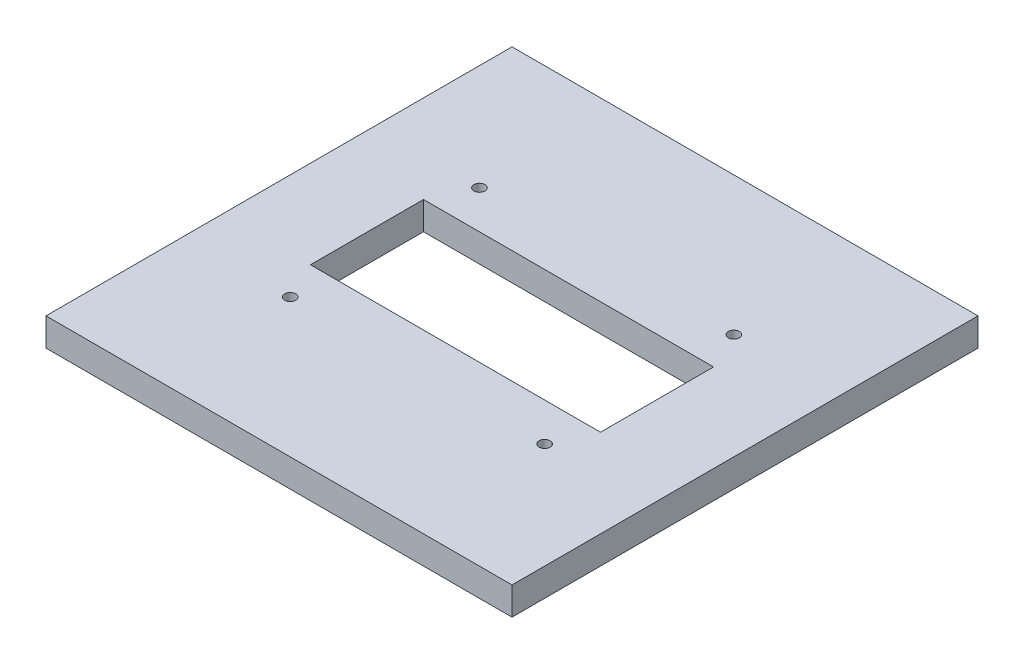
from build123d import *

# Parameters (mm, degrees)
ESBO_O1_W             = 50
ESBO_O1_H             = 50
BASE_DEPTH            = 3
ENTRADASESB_R         = 0.595
ENTRADASESB_W         = 31.12
ENTRADASESB_H         = 12.13
CORTE_EXTRUS_O1_DEPTH = 3


with BuildPart() as part:
    # Esboço1 → Base (new body)
    with BuildSketch(Plane(origin=(0, 0, 0), x_dir=(1, 0, 0), z_dir=(0, 1, 0))):
        with Locations((25, 25)):
            Rectangle(ESBO_O1_W, ESBO_O1_H)
    extrude(amount=BASE_DEPTH)

    # EntradasEsb → Corte-extrusão1 (cut)
    with BuildSketch(Plane(origin=(0, 3, 0), x_dir=(1, 0, 0), z_dir=(0, 1, 0))):
        with Locations((11.35, 35.155)):
            Circle(ENTRADASESB_R)
        with Locations((38.65, 35.155)):
            Circle(ENTRADASESB_R)
        with Locations((38.65, 14.845)):
            Circle(ENTRADASESB_R)
        with Locations((11.35, 14.845)):
            Circle(ENTRADASESB_R)
        with Locations((25, 25)):
            Rectangle(ENTRADASESB_W, ENTRADASESB_H)
    extrude(amount=-CORTE_EXTRUS_O1_DEPTH, mode=Mode.SUBTRACT)


solid = part.part
